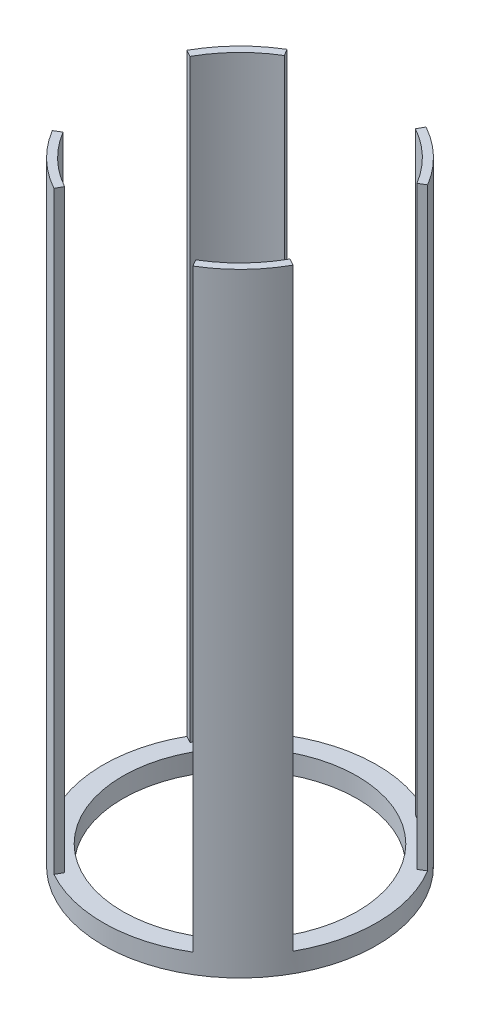
from build123d import *

# Parameters (mm, degrees)
SKETCH2_R               = 88.9
SKETCH2_R_2             = 83.82
BOSS_EXTRUDE1_DEPTH     = 199.39
CUT_EXTRUDE1_DEPTH      = 236.717610925
CUT_EXTRUDE1_DEPTH_BACK = 236.717610925
SKETCH4_R               = 88.9
SKETCH4_R_2             = 76.2
BOSS_EXTRUDE2_DEPTH     = 12.7


with BuildPart() as part:
    # Sketch2 → Boss-Extrude1 (new, symmetric)
    with BuildSketch(Plane(origin=(0, 0, 0), x_dir=(1, 0, 0), z_dir=(0, 1, 0))):
        Circle(SKETCH2_R)
        Circle(SKETCH2_R_2, mode=Mode.SUBTRACT)
    extrude(amount=BOSS_EXTRUDE1_DEPTH, both=True)

    # Sketch3 → Cut-Extrude1 (cut, two sides: drawn at the far end of the back side and taken through both)
    with BuildSketch(Plane(origin=(0, 0, 0), x_dir=(1, 0, 0), z_dir=(0, 1, 0)).offset(-CUT_EXTRUDE1_DEPTH_BACK)):
        Polygon((-58.116685864, 96.974944394), (0, 0), (53.900027233, 96.974944394), align=None)
        Polygon((70.991745134, -118.45858783), (0, 0), (-65.840936026, -118.45858783), align=None)
        Polygon((169.661755759, 101.677593364), (0, 0), (169.661755759, -94.300371224), align=None)
        Polygon((-123.741299607, -74.157652604), (0, 0), (-123.741299607, 68.777140945), align=None)
    extrude(amount=CUT_EXTRUDE1_DEPTH + CUT_EXTRUDE1_DEPTH_BACK, mode=Mode.SUBTRACT)


with BuildPart() as cut_extrude1_piece_1:
    # of the separate pieces the step leaves, piece 1, a body of its own (cut_extrude1_pieces)
    add(part.part.solids().sort_by_distance((-45.699187432, -199.39, -76.254798328))[0])



with BuildPart() as cut_extrude1_piece_2:
    # of the separate pieces the step leaves, piece 2, a body of its own (cut_extrude1_pieces)
    add(part.part.solids().sort_by_distance((45.699187432, -199.39, 76.254798328))[0])


with BuildPart() as cut_extrude1_piece_3:
    # of the separate pieces the step leaves, piece 3, a body of its own (cut_extrude1_pieces)
    add(part.part.solids().sort_by_distance((76.254798328, -199.39, -45.699187432))[0])


with BuildPart() as cut_extrude1_piece_4:
    # of the separate pieces the step leaves, piece 4, a body of its own (cut_extrude1_pieces)
    add(part.part.solids().sort_by_distance((-76.254798328, -199.39, 45.699187432))[0])


with BuildPart() as cut_extrude1_piece_1_1:
    add(cut_extrude1_piece_1.part)

    add(cut_extrude1_piece_2.part)  # Boss-Extrude2 merges Cut-Extrude1 piece 2

    add(cut_extrude1_piece_3.part)  # Boss-Extrude2 merges Cut-Extrude1 piece 3

    add(cut_extrude1_piece_4.part)  # Boss-Extrude2 merges Cut-Extrude1 piece 4
    # Sketch4 → Boss-Extrude2 (add)
    with BuildSketch(Plane.XZ.offset(199.39)):
        Circle(SKETCH4_R)
        Circle(SKETCH4_R_2, mode=Mode.SUBTRACT)
    extrude(amount=-BOSS_EXTRUDE2_DEPTH)


solid = cut_extrude1_piece_1_1.part
